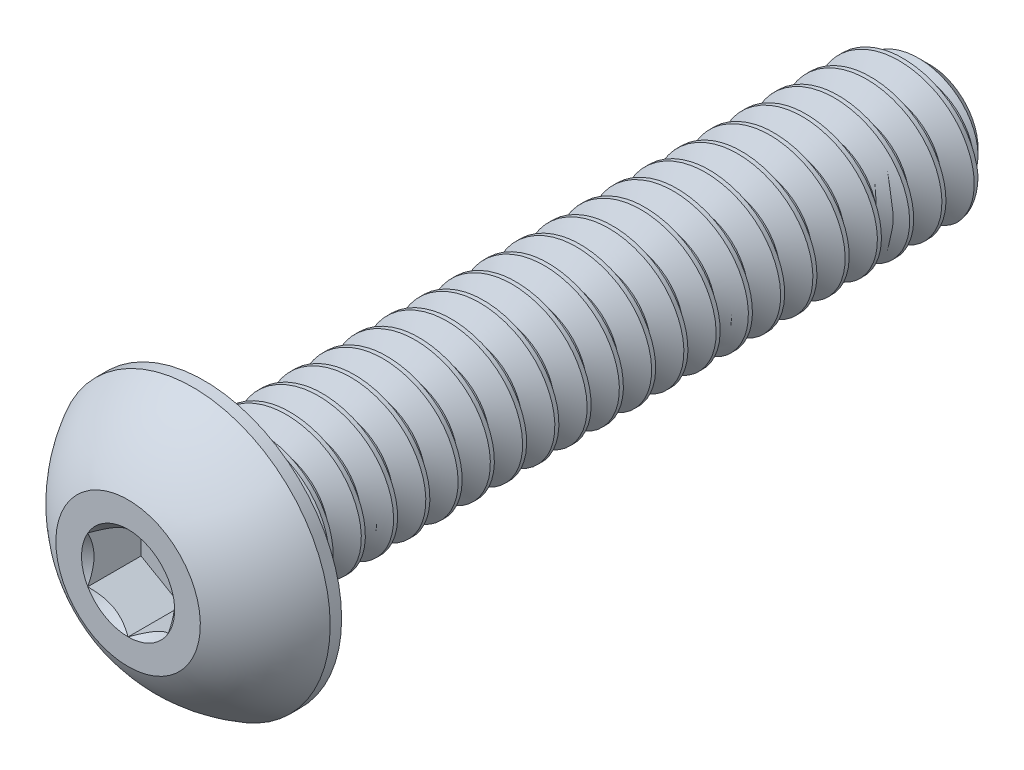
from build123d import *

# Parameters (mm, degrees)
SKETCH1_W          = 14.2875
SKETCH1_H          = 1.4224
CHAMFER1_SIZE      = 0.47625
CUT_SWEEP1_PITCH   = 0.635
CUT_EXTRUDE2_DEPTH = 1.04902


with BuildPart() as part:
    # Sketch1 → Revolve1 (revolve)
    with BuildSketch(Plane(origin=(0, 0, 0), x_dir=(0, 0, -1), z_dir=(1, 0, 0))):
        with Locations((8.64235, 0.7112)):
            Rectangle(SKETCH1_W, SKETCH1_H)
    revolve(axis=Axis((0, 0, -15.7861), (0, 0, 1)))

    # Chamfer1
    chamfer1_edges = [part.edges().sort_by_distance(p)[0] for p in [
        (0, -1.4224, -15.7861),
    ]]
    chamfer(chamfer1_edges, length=CHAMFER1_SIZE)

    # Cut-Sweep1: the profile of Sketch2 profile screwed along a right-hand helix of 23.5 turns, 6 arcs to a turn; built about Z, then put on its axis
    cut_sweep1_z = Axis((0, 0, 0), (0, 0, 1))
    cut_sweep1_corners = [(1.4227, 0, 0.000173205), (1.4227, 0, -0.555798205), (1.009955401, 0, -0.3175), (1.009955401, 0, -0.238125)]
    with BuildLine(mode=Mode.PRIVATE) as cut_sweep1_profile:
        Line(cut_sweep1_corners[0], cut_sweep1_corners[1])
        Line(cut_sweep1_corners[1], cut_sweep1_corners[2])
        Line(cut_sweep1_corners[2], cut_sweep1_corners[3])
        Line(cut_sweep1_corners[3], cut_sweep1_corners[0])
    cut_sweep1_cap = Face(cut_sweep1_profile.wire())
    cut_sweep1_turn_angles = [0, 30, 60, 90, 120, 150, 180, 210, 240, 270, 300, 330, 360]
    cut_sweep1_turn_weights = [1, 0.8660254037844387, 1, 0.8660254037844387, 1, 0.8660254037844387, 1, 0.8660254037844387, 1, 0.8660254037844387, 1, 0.8660254037844387, 1]
    cut_sweep1_turn_rails = [Edge.make_bspline([Vector(p[0], p[1], 0).rotate(cut_sweep1_z, cut_sweep1_turn_angles[k]) / cut_sweep1_turn_weights[k] + Vector(0, 0, p[2] + CUT_SWEEP1_PITCH * cut_sweep1_turn_angles[k] / 360) for k in range(13)], [0, 0, 0, 1, 1, 2, 2, 3, 3, 4, 4, 5, 5, 6, 6, 6], 2, cut_sweep1_turn_weights) for p in cut_sweep1_corners]
    cut_sweep1_turn_sides = [Face.make_surface_from_curves(cut_sweep1_turn_rails[p[0]], cut_sweep1_turn_rails[p[1]]) for p in [(0, 1), (1, 2), (2, 3), (3, 0)]]
    cut_sweep1_last_angles = [8280, 8310, 8340, 8370, 8400, 8430, 8460]
    cut_sweep1_last_weights = [1, 0.8660254037844387, 1, 0.8660254037844387, 1, 0.8660254037841847, 1]
    cut_sweep1_last_rails = [Edge.make_bspline([Vector(p[0], p[1], 0).rotate(cut_sweep1_z, cut_sweep1_last_angles[k]) / cut_sweep1_last_weights[k] + Vector(0, 0, p[2] + CUT_SWEEP1_PITCH * cut_sweep1_last_angles[k] / 360) for k in range(7)], [0, 0, 0, 1, 1, 2, 2, 3, 3, 3], 2, cut_sweep1_last_weights) for p in cut_sweep1_corners]
    cut_sweep1_last_sides = [Face.make_surface_from_curves(cut_sweep1_last_rails[p[0]], cut_sweep1_last_rails[p[1]]) for p in [(0, 1), (1, 2), (2, 3), (3, 0)]]
    cut_sweep1 = Plane(origin=(0, 0, -15.7861), x_dir=(0, 1, 0), z_dir=(0, 0, 1)) * Solid(Shell([*[p.moved(Location((0, 0, CUT_SWEEP1_PITCH * i))) for i in range(23) for p in cut_sweep1_turn_sides], *cut_sweep1_last_sides, cut_sweep1_cap, cut_sweep1_cap.rotate(cut_sweep1_z, 8460).moved(Location((0, 0, CUT_SWEEP1_PITCH * 8460 / 360)))]))
    add(cut_sweep1, mode=Mode.SUBTRACT)

    # Sketch7 → Revolve2 (revolve)
    with BuildSketch(Plane(origin=(0, 0, 0), x_dir=(0, 0, -1), z_dir=(1, 0, 0)), mode=Mode.PRIVATE) as revolve2_sk:
        with BuildLine():
            Line((1.27381, 2.7051), (1.4986, 2.7051))
            Line((1.4986, 2.7051), (1.4986, 0))
            Line((1.4986, 0), (0, 0))
            Line((0, 0), (0, 1.4224))
            ThreePointArc((0, 1.4224), (0.540190256, 2.159794444), (1.27381, 2.7051))
        make_face()
    revolve(revolve2_sk.sketch.rotate(Axis((0, 0, 0), (0, 0, -1)), 189.336081704), axis=Axis((0, 0, 0), (0, 0, -1)))

    # Sketch5 → Cut-Extrude2 (cut)
    with BuildSketch(Plane.XY):
        Polygon((0.79375, -0.458271776), (0.79375, 0.458271776), (0, 0.916543552), (-0.79375, 0.458271776), (-0.79375, -0.458271776), (0, -0.916543552), align=None)
    extrude(amount=-CUT_EXTRUDE2_DEPTH, mode=Mode.SUBTRACT)

    # Cut-Extrude3 cone 1 section (through the dimple's axis) → Cut-Extrude3 (revolve, cut)
    with BuildSketch(Plane(origin=(0, 0, 0), x_dir=(0, -1, 0), z_dir=(1, 0, 0))):
        Polygon((0, 0), (0.916543552, 0), (0, 0.916543552), align=None)
    revolve(axis=Axis((0, 0, 0), (0, 0, -1)), mode=Mode.SUBTRACT)


solid = part.part
